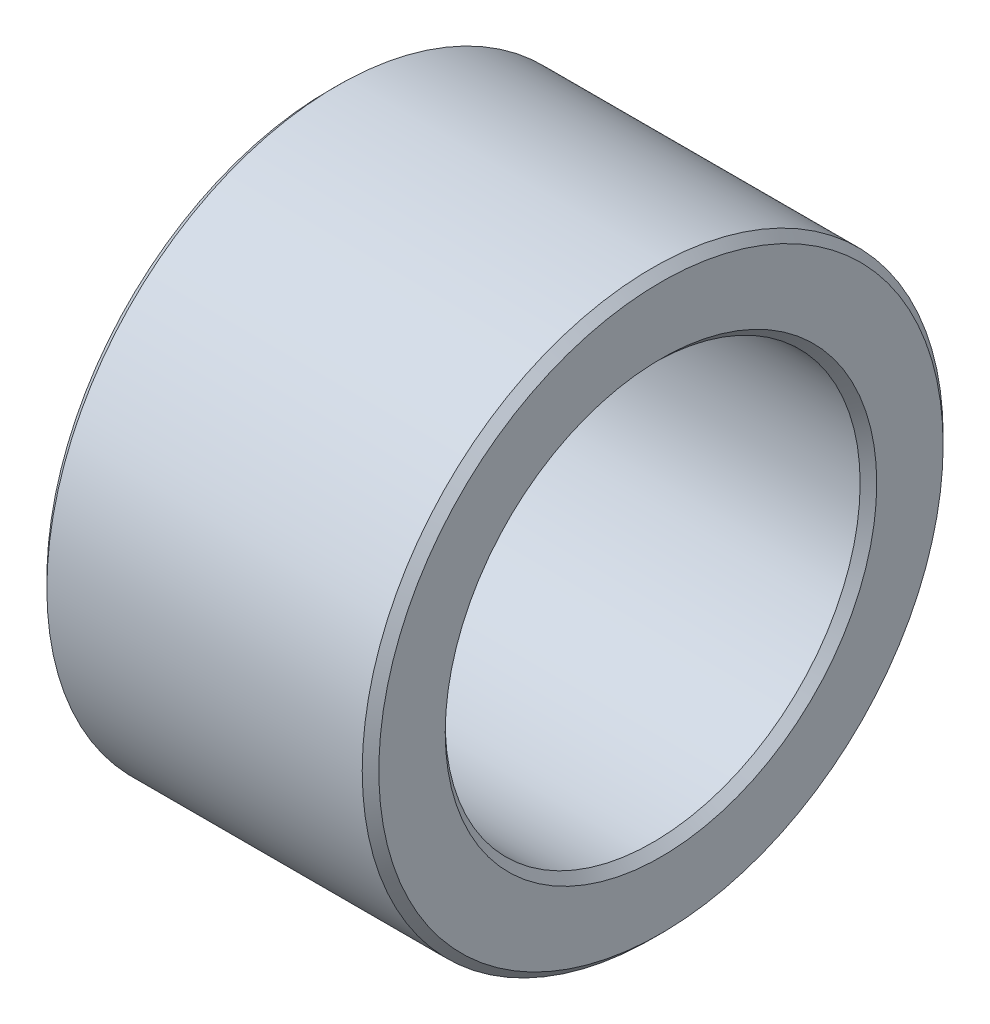
from build123d import *

# Parameters (mm, degrees)
SKETCH_1_R      = 3.5
SKETCH_1_R_2    = 2.5
EXTRUDE_1_DEPTH = 4
CHAMFER_1_SIZE  = 0.1


with BuildPart() as part:
    # 草图1 → 凸台-拉伸1 (new body)
    with BuildSketch(Plane.YZ):
        Circle(SKETCH_1_R)
        Circle(SKETCH_1_R_2, mode=Mode.SUBTRACT)
    extrude(amount=EXTRUDE_1_DEPTH)

    # 倒角1
    chamfer_1_edges = [part.edges().sort_by_distance(p)[0] for p in [
        (4, -2.5, 0),
        (0, -2.5, 0),
        (0, -3.5, 0),
        (4, -3.5, 0),
    ]]
    chamfer(chamfer_1_edges, length=CHAMFER_1_SIZE)


solid = part.part
